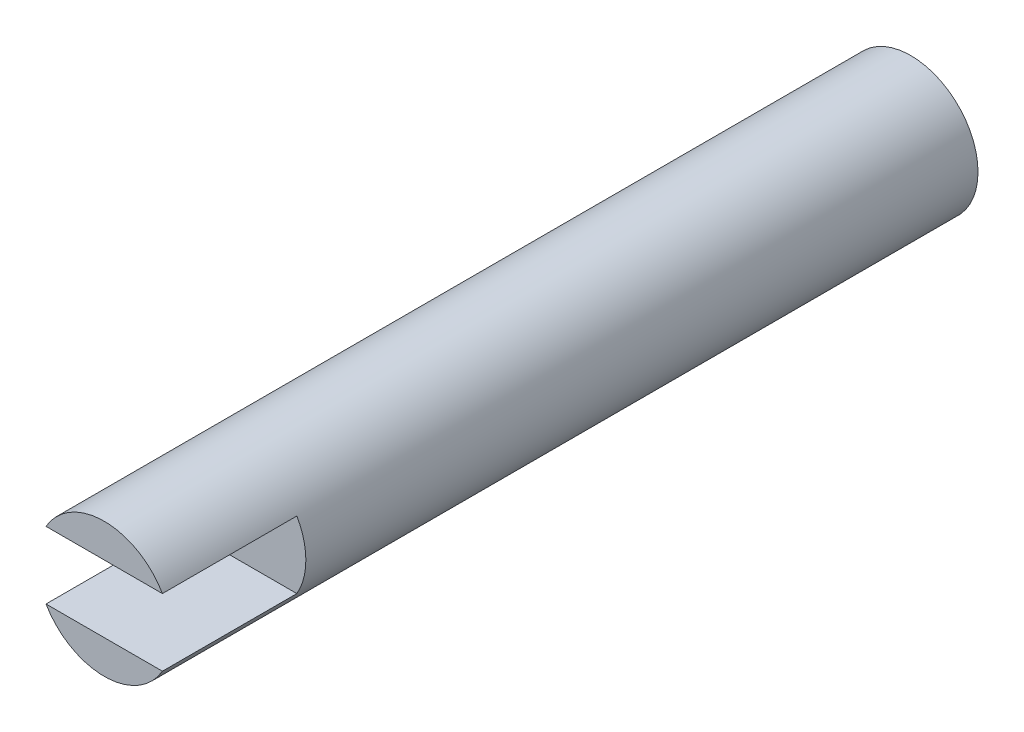
from build123d import *

# Parameters (mm, degrees)
BOSS_EXTRUDE1_DEPTH      = 25.4
BOSS_EXTRUDE1_DEPTH_BACK = 279.4
SKETCH1_R                = 25.4
CUT_EXTRUDE2_DEPTH       = 282.699627263
CUT_EXTRUDE2_DEPTH_BACK  = 282.699627263
SKETCH3_W                = 50.8
SKETCH3_H                = 25.4


with BuildPart() as part:
    # Sketch1 → Boss-Extrude1 (new, two sides: drawn at the far end of the back side and taken through both)
    with BuildSketch(Plane.XY.offset(-BOSS_EXTRUDE1_DEPTH_BACK)):
        Circle(SKETCH1_R)
    extrude(amount=BOSS_EXTRUDE1_DEPTH + BOSS_EXTRUDE1_DEPTH_BACK)

    # Sketch3 → Cut-Extrude2 (cut, two sides: drawn at the far end of the back side and taken through both)
    with BuildSketch(Plane(origin=(0, 0, 0), x_dir=(0, 0, -1), z_dir=(1, 0, 0)).offset(-CUT_EXTRUDE2_DEPTH_BACK)):
        Rectangle(SKETCH3_W, SKETCH3_H)
    extrude(amount=CUT_EXTRUDE2_DEPTH + CUT_EXTRUDE2_DEPTH_BACK, mode=Mode.SUBTRACT)


solid = part.part
